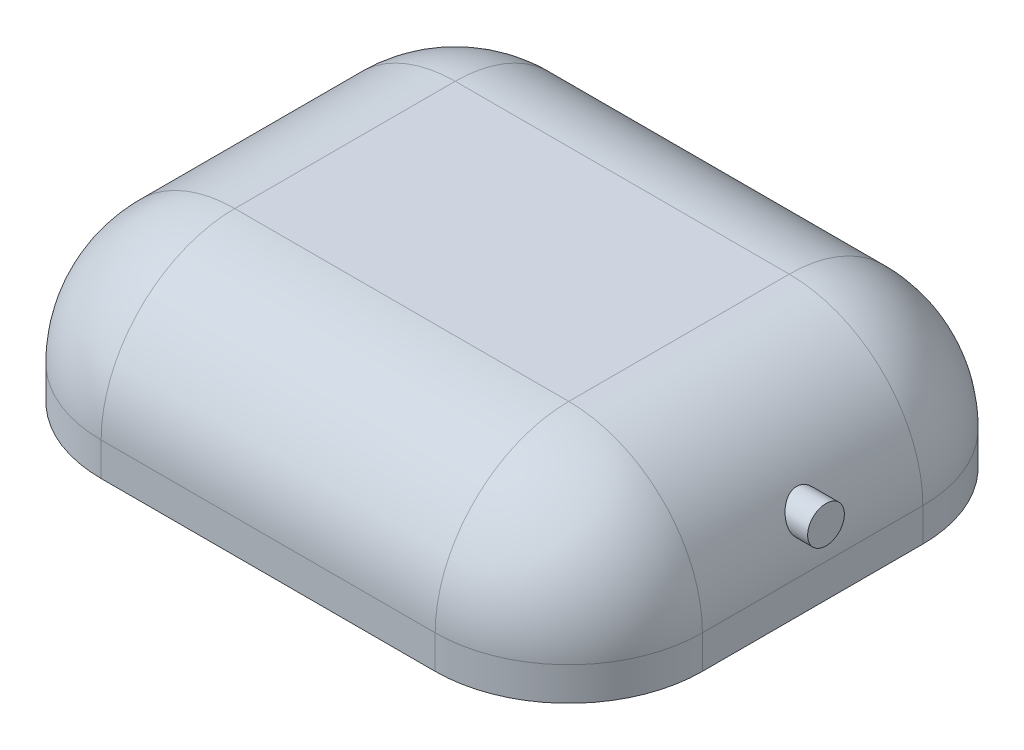
from build123d import *

# Parameters (mm, degrees)
SKETCH1_W                          = 45
SKETCH1_H                          = 36.5
BOSS_EXTRUDE1_DEPTH                = 12.5
SKETCH2_R                          = 1.375
BOSS_EXTRUDE2_DEPTH                = 1
TAP_DRILL_FOR_M2_5X0_45_TAP1_D     = 2.05
TAP_DRILL_FOR_M2_5X0_45_TAP1_DEPTH = 3
TAP_DRILL_FOR_M2_5X0_45_TAP1_TIP   = 0.615882135
FILLET1_R                          = 10


with BuildPart() as part:
    # Sketch1 → Boss-Extrude1 (new body)
    with BuildSketch(Plane(origin=(0, 0, 0), x_dir=(1, 0, 0), z_dir=(0, 1, 0))):
        Rectangle(SKETCH1_W, SKETCH1_H)
    extrude(amount=BOSS_EXTRUDE1_DEPTH)

    # Sketch2 → Boss-Extrude2 (add)
    with BuildSketch(Plane(origin=(22.5, 0, 0), x_dir=(0, 0, -1), z_dir=(1, 0, 0))):
        with Locations(Location((0, 5.884601179, 0), (0, 0, 180))):
            Circle(SKETCH2_R)
    extrude(amount=BOSS_EXTRUDE2_DEPTH)

    # Tap Drill for M2.5x0.45 Tap1
    with Locations(Plane(origin=(0, 0, 0), x_dir=(-1, 0, 0), z_dir=(0, -1, 0))):
        with Locations((15.6, 7.25), (-14.1, -7.65)):
            Hole(TAP_DRILL_FOR_M2_5X0_45_TAP1_D / 2, depth=TAP_DRILL_FOR_M2_5X0_45_TAP1_DEPTH)
            with Locations((0, 0, -(TAP_DRILL_FOR_M2_5X0_45_TAP1_DEPTH + TAP_DRILL_FOR_M2_5X0_45_TAP1_TIP / 2))):  # 118° drill point
                Cone(0, TAP_DRILL_FOR_M2_5X0_45_TAP1_D / 2, TAP_DRILL_FOR_M2_5X0_45_TAP1_TIP, mode=Mode.SUBTRACT)

    # Fillet1
    # the kernel refuses this fillet: 10 mm, written as the material it takes off along each edge
    with BuildSketch(Plane(origin=(12.5, 2.5, 8.25), x_dir=(1, 0, 0), z_dir=(0, 0, 1))) as fillet1_piece_1_section:
        Polygon((0, 0), (FILLET1_R, 0), (FILLET1_R, FILLET1_R), (0, FILLET1_R), align=None)
    fillet1_piece_1 = extrude(amount=FILLET1_R, mode=Mode.PRIVATE)
    fillet1_piece_1 = fillet1_piece_1 - Plane(origin=(12.5, 2.5, 8.25), x_dir=(-0.7071067811865475, -0.7071067811865475, 0), z_dir=(0, 0, 1)) * Sphere(FILLET1_R, mode=Mode.PRIVATE)
    add(fillet1_piece_1, mode=Mode.SUBTRACT)
    with BuildSketch(Plane(origin=(12.5, 2.5, -8.25), x_dir=(0, 1, 0), z_dir=(1, 0, 0))) as fillet1_piece_2_section:
        Polygon((0, 0), (FILLET1_R, 0), (FILLET1_R, -FILLET1_R), (0, -FILLET1_R), align=None)
    fillet1_piece_2 = extrude(amount=FILLET1_R, mode=Mode.PRIVATE)
    fillet1_piece_2 = fillet1_piece_2 - Plane(origin=(12.5, 2.5, -8.25), x_dir=(0, -0.7071067811865475, 0.7071067811865475), z_dir=(1, 0, 0)) * Sphere(FILLET1_R, mode=Mode.PRIVATE)
    add(fillet1_piece_2, mode=Mode.SUBTRACT)
    with BuildSketch(Plane(origin=(-12.5, 2.5, 8.25), x_dir=(-1, 0, 0), z_dir=(0, 0, 1))) as fillet1_piece_3_section:
        Polygon((0, 0), (FILLET1_R, 0), (FILLET1_R, -FILLET1_R), (0, -FILLET1_R), align=None)
    fillet1_piece_3 = extrude(amount=FILLET1_R, mode=Mode.PRIVATE)
    fillet1_piece_3 = fillet1_piece_3 - Plane(origin=(-12.5, 2.5, 8.25), x_dir=(0.7071067811865475, -0.7071067811865475, 0), z_dir=(0, 0, 1)) * Sphere(FILLET1_R, mode=Mode.PRIVATE)
    add(fillet1_piece_3, mode=Mode.SUBTRACT)
    with BuildSketch(Plane(origin=(-12.5, 2.5, -8.25), x_dir=(0, 1, 0), z_dir=(-1, 0, 0))) as fillet1_piece_4_section:
        Polygon((0, 0), (FILLET1_R, 0), (FILLET1_R, FILLET1_R), (0, FILLET1_R), align=None)
    fillet1_piece_4 = extrude(amount=FILLET1_R, mode=Mode.PRIVATE)
    fillet1_piece_4 = fillet1_piece_4 - Plane(origin=(-12.5, 2.5, -8.25), x_dir=(0, -0.7071067811865475, 0.7071067811865475), z_dir=(-1, 0, 0)) * Sphere(FILLET1_R, mode=Mode.PRIVATE)
    add(fillet1_piece_4, mode=Mode.SUBTRACT)
    with BuildSketch(Plane(origin=(22.5, 12.5, 8.25), x_dir=(0, -1, 0), z_dir=(0, 0, -1))) as fillet1_piece_5_section:
        with BuildLine():
            CenterArc((FILLET1_R, FILLET1_R), FILLET1_R, 180, 90)
            Line((0, FILLET1_R), (0, 0))
            Line((0, 0), (FILLET1_R, 0))
        make_face()
    fillet1_piece_5 = extrude(amount=16.5, mode=Mode.PRIVATE)
    fillet1_piece_5 = fillet1_piece_5 - Plane(origin=(20.212473713, 5.884601179, 0), x_dir=(0, 0, 1), z_dir=(-1, 0, 0)) * Cylinder(1.375, 73, mode=Mode.PRIVATE)
    add(fillet1_piece_5, mode=Mode.SUBTRACT)
    with BuildSketch(Plane(origin=(-12.5, 12.5, 18.25), x_dir=(0, -1, 0), z_dir=(1, 0, 0))) as fillet1_piece_6:
        with BuildLine():
            CenterArc((FILLET1_R, FILLET1_R), FILLET1_R, 180, 90)
            Line((0, FILLET1_R), (0, 0))
            Line((0, 0), (FILLET1_R, 0))
        make_face()
    extrude(amount=25, mode=Mode.SUBTRACT)
    with BuildSketch(Plane(origin=(-22.5, 12.5, -8.25), x_dir=(0, -1, 0), z_dir=(0, 0, 1))) as fillet1_piece_7:
        with BuildLine():
            CenterArc((FILLET1_R, FILLET1_R), FILLET1_R, 180, 90)
            Line((0, FILLET1_R), (0, 0))
            Line((0, 0), (FILLET1_R, 0))
        make_face()
    extrude(amount=16.5, mode=Mode.SUBTRACT)
    with BuildSketch(Plane(origin=(12.5, 12.5, -18.25), x_dir=(0, 0, 1), z_dir=(-1, 0, 0))) as fillet1_piece_8:
        with BuildLine():
            CenterArc((FILLET1_R, -FILLET1_R), FILLET1_R, 90, 90)
            Line((0, -FILLET1_R), (0, 0))
            Line((0, 0), (FILLET1_R, 0))
        make_face()
    extrude(amount=25, mode=Mode.SUBTRACT)
    with BuildSketch(Plane(origin=(-22.5, -25, 18.25), x_dir=(1, 0, 0), z_dir=(0, 1, 0)), Plane(origin=(-22.5, -25, -18.25), x_dir=(0, 0, 1), z_dir=(0, 1, 0))) as fillet1_piece_9:
        with BuildLine():
            CenterArc((FILLET1_R, FILLET1_R), FILLET1_R, 180, 90)
            Line((0, FILLET1_R), (0, 0))
            Line((0, 0), (FILLET1_R, 0))
        make_face()
    extrude(amount=27.5, mode=Mode.SUBTRACT)
    with BuildSketch(Plane(origin=(22.5, -25, 18.25), x_dir=(-1, 0, 0), z_dir=(0, 1, 0)), Plane(origin=(22.5, -25, -18.25), x_dir=(0, 0, 1), z_dir=(0, 1, 0))) as fillet1_piece_10:
        with BuildLine():
            CenterArc((FILLET1_R, -FILLET1_R), FILLET1_R, 90, 90)
            Line((0, -FILLET1_R), (0, 0))
            Line((0, 0), (FILLET1_R, 0))
        make_face()
    extrude(amount=27.5, mode=Mode.SUBTRACT)


solid = part.part
